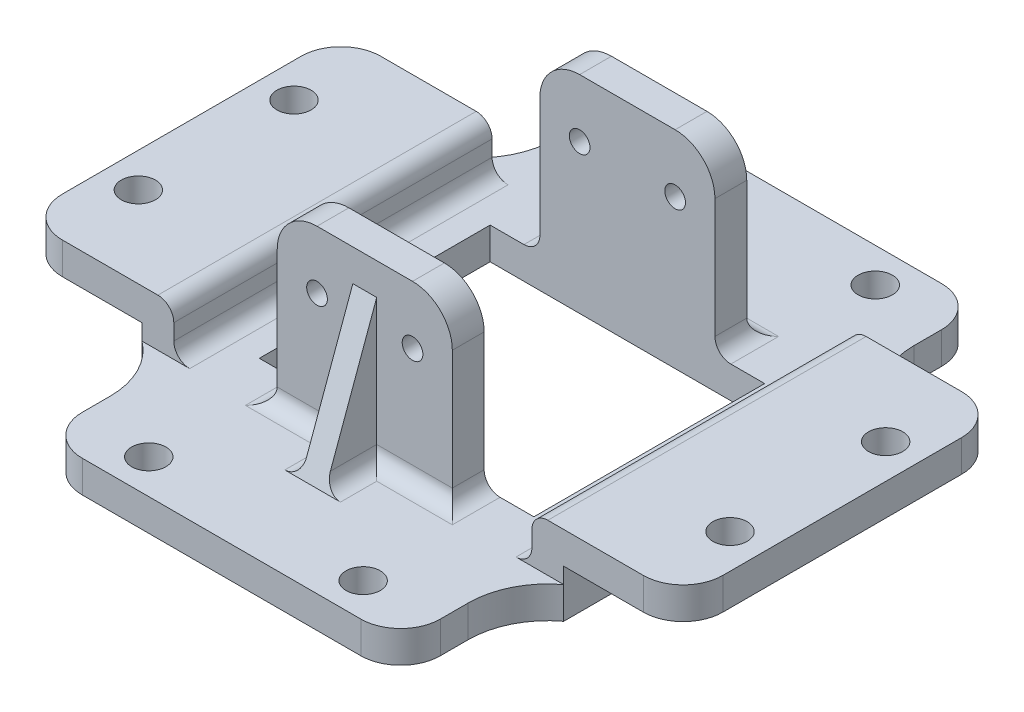
from build123d import *

# Parameters (mm, degrees)
SKETCH1_W             = 45
SKETCH1_H             = 73
SKETCH1_W_2           = 34.5
SKETCH1_H_2           = 29
BOSS_EXTRUDE1_DEPTH   = 4
BOSS_EXTRUDE2_DEPTH   = 20
SKETCH6_W             = 22
SKETCH6_H             = 4
BOSS_EXTRUDE3_DEPTH   = 22
F_6_CLEARANCE_HOLE1_D = 4.3053
F_6_CLEARANCE_HOLE2_D = 4.3053
M2_CLEARANCE_HOLE1_D  = 2.6
RIB3_REACH            = 63.078
SKETCH12_WALL_W       = 140.31113285
SKETCH12_WALL_H       = 3
RIB4_REACH            = 63.078
SKETCH13_WALL_W       = 143.310838334
SKETCH13_WALL_H       = 3
FILLET2_R             = 2
FILLET3_R             = 5
FILLET4_R             = 10


with BuildPart() as part:
    # Sketch1 → Boss-Extrude1 (new body)
    with BuildSketch(Plane(origin=(0, 0, 0), x_dir=(1, 0, 0), z_dir=(0, 1, 0))):
        Rectangle(SKETCH1_W, SKETCH1_H)
        Rectangle(SKETCH1_W_2, SKETCH1_H_2, mode=Mode.SUBTRACT)
    extrude(amount=BOSS_EXTRUDE1_DEPTH)

    # Sketch2 → Boss-Extrude2 (add, symmetric)
    with BuildSketch(Plane.XY):
        Polygon((-22.5, 4), (-22.5, 10), (-41.5, 10), (-41.5, 6), (-26.5, 6), (-26.5, 0), (-22.5, 0), align=None)
    boss_extrude2 = extrude(amount=BOSS_EXTRUDE2_DEPTH, both=True)

    # Sketch6 → Boss-Extrude3 (add)
    with BuildSketch(Plane(origin=(0, 4, 0), x_dir=(1, 0, 0), z_dir=(0, 1, 0))):
        with Locations((0, -16.5)):
            Rectangle(SKETCH6_W, SKETCH6_H)
    boss_extrude3 = extrude(amount=BOSS_EXTRUDE3_DEPTH)

    # #6 Clearance Hole1 (through all)
    with Locations(Plane(origin=(0, 6, 0), x_dir=(-1, 0, 0), z_dir=(0, -1, 0))):
        with Locations((37.175, -9.779), (37.175, 9.779)):
            f_6_clearance_hole1 = Hole(F_6_CLEARANCE_HOLE1_D / 2)

    # #6 Clearance Hole2 (through all)
    with Locations(Plane(origin=(0, 4, 0), x_dir=(1, 0, 0), z_dir=(0, 1, 0))):
        with Locations((-13.470384182, -32.175), (13.470384182, -32.175)):
            f_6_clearance_hole2 = Hole(F_6_CLEARANCE_HOLE2_D / 2)

    # M2 Clearance Hole1 (through all)
    with Locations(Plane.XY.offset(18.5)):
        with Locations((6, 18.7), (-6, 18.7)):
            m2_clearance_hole1 = Hole(M2_CLEARANCE_HOLE1_D / 2)

    # Sketch12 wall → Rib3 (add, up to next)
    with BuildSketch(Plane(origin=(-34, 3, 0), x_dir=(-0.928476690885, 0.371390676354, 0), z_dir=(-0.371390676354, -0.928476690885, 0)), mode=Mode.PRIVATE) as rib3_sk1:
        Rectangle(SKETCH12_WALL_W, SKETCH12_WALL_H)
    rib3_tool1 = extrude(rib3_sk1.sketch, amount=-RIB3_REACH, mode=Mode.PRIVATE) - part.part
    rib3 = rib3_tool1.solids().sort_by_distance((-34, 3, 0))[0]
    add(rib3)

    # Sketch13 wall → Rib4 (add, up to next)
    with BuildSketch(Plane(origin=(0, 13, 21.775732109), x_dir=(0, 0.939692620782, -0.342020143335), z_dir=(0, 0.342020143335, 0.939692620782)), mode=Mode.PRIVATE) as rib4_sk1:
        Rectangle(SKETCH13_WALL_W, SKETCH13_WALL_H)
    rib4_tool1 = extrude(rib4_sk1.sketch, amount=-RIB4_REACH, mode=Mode.PRIVATE) - part.part
    rib4 = rib4_tool1.solids().sort_by_distance((0, 13, 21.775732109))[0]
    add(rib4)

    # Mirror1: Boss-Extrude3, #6 Clearance Hole2, M2 Clearance Hole1, Rib4 across plane
    add(boss_extrude3.mirror(Plane.XY))
    add(f_6_clearance_hole2.mirror(Plane.XY), mode=Mode.SUBTRACT)
    add(m2_clearance_hole1.mirror(Plane.XY), mode=Mode.SUBTRACT)
    add(rib4.mirror(Plane.XY))

    # Mirror4: Boss-Extrude2, #6 Clearance Hole1, Rib3 across plane
    add(boss_extrude2.mirror(Plane(origin=(0, 0, 0), x_dir=(0, 0, 1), z_dir=(1, 0, 0))))
    add(f_6_clearance_hole1.mirror(Plane(origin=(0, 0, 0), x_dir=(0, 0, 1), z_dir=(1, 0, 0))), mode=Mode.SUBTRACT)
    add(rib3.mirror(Plane(origin=(0, 0, 0), x_dir=(0, 0, 1), z_dir=(1, 0, 0))))

    # Fillet2
    fillet2_edges = [part.edges().sort_by_distance(p)[0] for p in [
        (6.25, 4, 18.5),
        (1.5, 4, 21.775732109),
        (-1.5, 4, 21.775732109),
        (-11, 4, -16.5),
        (-6.25, 4, -18.5),
        (11, 4, -16.5),
        (6.25, 4, -18.5),
        (1.5, 4, -21.775732109),
        (-1.5, 4, -21.775732109),
        (22.5, 4, 0),
        (22.5, 10, 0),
        (-22.5, 4, 0),
        (-22.5, 10, 0),
        (-11, 4, 16.5),
        (-6.25, 4, 18.5),
        (11, 4, 16.5),
    ]]
    fillet(fillet2_edges, radius=FILLET2_R)

    # Fillet3
    fillet3_edges = [part.edges().sort_by_distance(p)[0] for p in [
        (-11, 26, -16.5),
        (11, 26, -16.5),
        (41.5, 8, 20),
        (41.5, 8, -20),
        (-41.5, 8, -20),
        (-41.5, 8, 20),
        (-11, 26, 16.5),
        (11, 26, 16.5),
        (-22.5, 2, -36.5),
        (22.5, 2, -36.5),
        (22.5, 2, 36.5),
        (-22.5, 2, 36.5),
    ]]
    fillet(fillet3_edges, radius=FILLET3_R)

    # Fillet4
    # the kernel refuses this fillet: 10 mm, written as the material it adds along each edge
    with BuildSketch(Plane(origin=(22.5, 4, 20), x_dir=(1, 0, 0), z_dir=(0, -1, 0))) as fillet4_piece_1:
        with BuildLine():
            CenterArc((10, 8), FILLET4_R, 180, 53.130102354)
            Line((0, 8), (0, 0))
            Line((0, 0), (4, 0))
        make_face()
    extrude(amount=4)
    with BuildSketch(Plane(origin=(22.5, 0, -20), x_dir=(0, 0, -1), z_dir=(0, 1, 0))) as fillet4_piece_2:
        with BuildLine():
            CenterArc((8, -10), FILLET4_R, 90, 53.130102354)
            Line((0, -4), (0, 0))
            Line((0, 0), (8, 0))
        make_face()
    extrude(amount=4)
    with BuildSketch(Plane(origin=(-22.5, 0, -20), x_dir=(0, 0, -1), z_dir=(0, 1, 0))) as fillet4_piece_3:
        with BuildLine():
            CenterArc((8, 10), FILLET4_R, 216.869897646, 53.130102354)
            Line((0, 4), (0, 0))
            Line((0, 0), (8, 0))
        make_face()
    extrude(amount=4)
    with BuildSketch(Plane(origin=(-22.5, 4, 20), x_dir=(-1, 0, 0), z_dir=(0, -1, 0))) as fillet4_piece_4:
        with BuildLine():
            CenterArc((10, -8), FILLET4_R, 126.869897646, 53.130102354)
            Line((0, -8), (0, 0))
            Line((0, 0), (4, 0))
        make_face()
    extrude(amount=4)


solid = part.part
